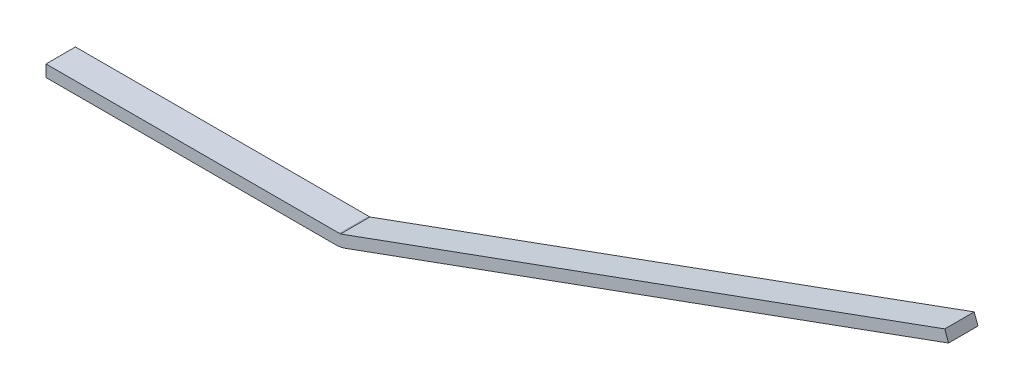
from build123d import *

# Parameters (mm, degrees)
DODANIE_WYCI_GNI_CIE1_DEPTH = 50
ZAOKR_GLENIE1_R             = 50


with BuildPart() as part:
    # Szkic1 → Dodanie-wyciągnięcie1 (new body)
    with BuildSketch(Plane.XY):
        Polygon((-250, -10), (250, -10), (1282.526348129, 365.808856814), (1276.107770084, 383.443755056), (250, 9.971069596), (250, 10), (-250, 10), align=None)
    extrude(amount=DODANIE_WYCI_GNI_CIE1_DEPTH)

    # Zaokrąglenie1
    # the kernel refuses this fillet: 50 mm, written as the material it takes off along each edge
    with BuildSketch(Plane(origin=(250, 10, -4.251619831), x_dir=(0, -1, 0), z_dir=(0, 0, 1))) as zaokr_glenie1_piece_1:
        with BuildLine():
            CenterArc((50, -1.700647932), ZAOKR_GLENIE1_R, 178.05082507, 1.94917493)
            Line((0, -1.700647932), (0, 0))
            Line((0, 0), (0.028930404, 0))
        make_face()
    extrude(amount=58.503239662, mode=Mode.SUBTRACT)
    with BuildSketch(Plane(origin=(250, -10, -22.040872589), x_dir=(-1, 0, 0), z_dir=(0, 0, 1))) as zaokr_glenie1_piece_2:
        with BuildLine():
            CenterArc((ZAOKR_GLENIE1_R * 0.176326980708, -ZAOKR_GLENIE1_R), ZAOKR_GLENIE1_R, 90, 20)
            Line((-ZAOKR_GLENIE1_R * 0.165693162617, -ZAOKR_GLENIE1_R * 0.0603073792141), (0, 0))
            Line((0, 0), (ZAOKR_GLENIE1_R * 0.176326980708, 0))
        make_face()
    extrude(amount=94.081745177, mode=Mode.SUBTRACT)


solid = part.part
